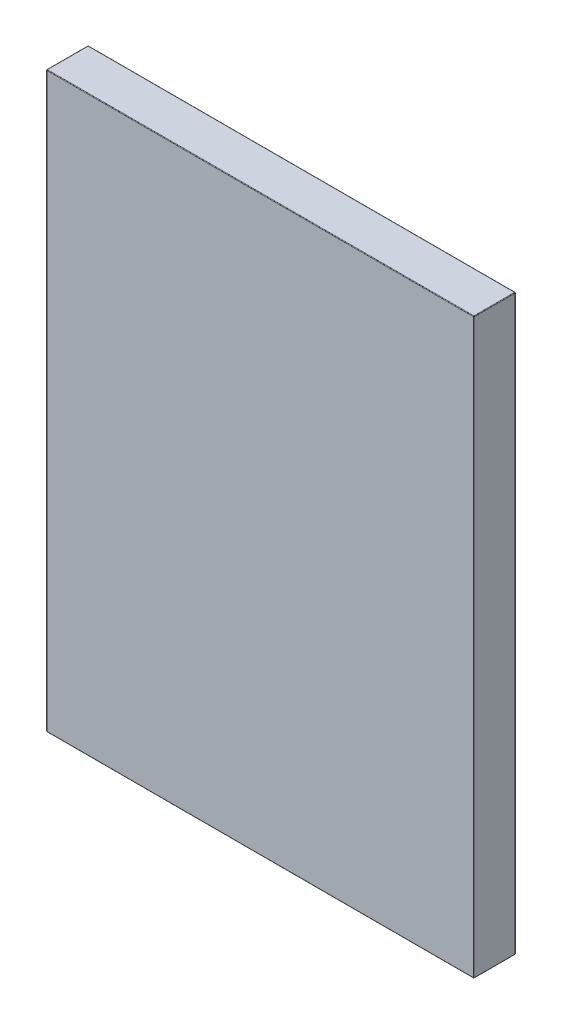
from build123d import *

# Parameters (mm, degrees)
SKETCH_1_W      = 820
SKETCH_1_H      = 1100
EXTRUDE_1_DEPTH = 80
FILLET_1_R      = 1
FILLET_2_R      = 1


with BuildPart() as part:
    # Эскиз1 → Бобышка-Вытянуть1 (new body)
    with BuildSketch(Plane.XY):
        Rectangle(SKETCH_1_W, SKETCH_1_H)
    extrude(amount=EXTRUDE_1_DEPTH)

    # Скругление1
    fillet_1_edges = [part.edges().sort_by_distance(p)[0] for p in [
        (0, -550, 0),
        (-410, 0, 0),
        (0, 550, 0),
        (410, 0, 0),
    ]]
    fillet(fillet_1_edges, radius=FILLET_1_R)

    # Скругление2
    # the kernel refuses this fillet: 1 mm, written as the material it takes off along each edge
    with BuildSketch(Plane(origin=(409, -549, 1), x_dir=(0, -1, 0), z_dir=(1, 0, 0))) as fillet_2_piece_1_section:
        Polygon((0, 0), (FILLET_2_R, 0), (FILLET_2_R, FILLET_2_R), (0, FILLET_2_R), align=None)
    fillet_2_piece_1 = extrude(amount=FILLET_2_R, mode=Mode.PRIVATE)
    fillet_2_piece_1 = fillet_2_piece_1 - Plane(origin=(409, -549, 1), x_dir=(0, 0.7071067811865475, 0.7071067811865475), z_dir=(1, 0, 0)) * Sphere(FILLET_2_R, mode=Mode.PRIVATE)
    add(fillet_2_piece_1, mode=Mode.SUBTRACT)
    with BuildSketch(Plane(origin=(-409, -549, 1), x_dir=(0, -1, 0), z_dir=(-1, 0, 0))) as fillet_2_piece_2_section:
        Polygon((0, 0), (FILLET_2_R, 0), (FILLET_2_R, -FILLET_2_R), (0, -FILLET_2_R), align=None)
    fillet_2_piece_2 = extrude(amount=FILLET_2_R, mode=Mode.PRIVATE)
    fillet_2_piece_2 = fillet_2_piece_2 - Plane(origin=(-409, -549, 1), x_dir=(0, 0.7071067811865475, 0.7071067811865475), z_dir=(-1, 0, 0)) * Sphere(FILLET_2_R, mode=Mode.PRIVATE)
    add(fillet_2_piece_2, mode=Mode.SUBTRACT)
    with BuildSketch(Plane(origin=(409, 549, 1), x_dir=(1, 0, 0), z_dir=(0, 1, 0))) as fillet_2_piece_3_section:
        Polygon((0, 0), (FILLET_2_R, 0), (FILLET_2_R, FILLET_2_R), (0, FILLET_2_R), align=None)
    fillet_2_piece_3 = extrude(amount=FILLET_2_R, mode=Mode.PRIVATE)
    fillet_2_piece_3 = fillet_2_piece_3 - Plane(origin=(409, 549, 1), x_dir=(-0.7071067811865475, 0, 0.7071067811865475), z_dir=(0, 1, 0)) * Sphere(FILLET_2_R, mode=Mode.PRIVATE)
    add(fillet_2_piece_3, mode=Mode.SUBTRACT)
    with BuildSketch(Plane(origin=(-409, 549, 1), x_dir=(-1, 0, 0), z_dir=(0, 1, 0))) as fillet_2_piece_4_section:
        Polygon((0, 0), (FILLET_2_R, 0), (FILLET_2_R, -FILLET_2_R), (0, -FILLET_2_R), align=None)
    fillet_2_piece_4 = extrude(amount=FILLET_2_R, mode=Mode.PRIVATE)
    fillet_2_piece_4 = fillet_2_piece_4 - Plane(origin=(-409, 549, 1), x_dir=(0.7071067811865475, 0, 0.7071067811865475), z_dir=(0, 1, 0)) * Sphere(FILLET_2_R, mode=Mode.PRIVATE)
    add(fillet_2_piece_4, mode=Mode.SUBTRACT)
    with BuildSketch(Plane(origin=(-409, -549, 79), x_dir=(0, 0, 1), z_dir=(-1, 0, 0))) as fillet_2_piece_5_section:
        Polygon((0, 0), (FILLET_2_R, 0), (FILLET_2_R, -FILLET_2_R), (0, -FILLET_2_R), align=None)
    fillet_2_piece_5 = extrude(amount=FILLET_2_R, mode=Mode.PRIVATE)
    fillet_2_piece_5 = fillet_2_piece_5 - Plane(origin=(-409, -549, 79), x_dir=(0, 0.7071067811865475, -0.7071067811865475), z_dir=(-1, 0, 0)) * Sphere(FILLET_2_R, mode=Mode.PRIVATE)
    add(fillet_2_piece_5, mode=Mode.SUBTRACT)
    with BuildSketch(Plane(origin=(-409, 549, 79), x_dir=(-1, 0, 0), z_dir=(0, 1, 0))) as fillet_2_piece_6_section:
        Polygon((0, 0), (FILLET_2_R, 0), (FILLET_2_R, FILLET_2_R), (0, FILLET_2_R), align=None)
    fillet_2_piece_6 = extrude(amount=FILLET_2_R, mode=Mode.PRIVATE)
    fillet_2_piece_6 = fillet_2_piece_6 - Plane(origin=(-409, 549, 79), x_dir=(0.7071067811865475, 0, -0.7071067811865475), z_dir=(0, 1, 0)) * Sphere(FILLET_2_R, mode=Mode.PRIVATE)
    add(fillet_2_piece_6, mode=Mode.SUBTRACT)
    with BuildSketch(Plane(origin=(409, -549, 79), x_dir=(1, 0, 0), z_dir=(0, 0, 1))) as fillet_2_piece_7_section:
        Polygon((0, 0), (FILLET_2_R, 0), (FILLET_2_R, -FILLET_2_R), (0, -FILLET_2_R), align=None)
    fillet_2_piece_7 = extrude(amount=FILLET_2_R, mode=Mode.PRIVATE)
    fillet_2_piece_7 = fillet_2_piece_7 - Plane(origin=(409, -549, 79), x_dir=(-0.7071067811865476, 0.7071067811865475, 0), z_dir=(0, 0, 1)) * Sphere(FILLET_2_R, mode=Mode.PRIVATE)
    add(fillet_2_piece_7, mode=Mode.SUBTRACT)
    with BuildSketch(Plane(origin=(409, 549, 79), x_dir=(0, 0, 1), z_dir=(0, 1, 0))) as fillet_2_piece_8_section:
        Polygon((0, 0), (FILLET_2_R, 0), (FILLET_2_R, FILLET_2_R), (0, FILLET_2_R), align=None)
    fillet_2_piece_8 = extrude(amount=FILLET_2_R, mode=Mode.PRIVATE)
    fillet_2_piece_8 = fillet_2_piece_8 - Plane(origin=(409, 549, 79), x_dir=(-0.7071067811865475, 0, -0.7071067811865475), z_dir=(0, 1, 0)) * Sphere(FILLET_2_R, mode=Mode.PRIVATE)
    add(fillet_2_piece_8, mode=Mode.SUBTRACT)
    with BuildSketch(Plane(origin=(-410, -549, 80), x_dir=(0, 0, -1), z_dir=(0, 1, 0))) as fillet_2_piece_9:
        with BuildLine():
            CenterArc((FILLET_2_R, -FILLET_2_R), FILLET_2_R, 90, 90)
            Line((0, -FILLET_2_R), (0, 0))
            Line((0, 0), (FILLET_2_R, 0))
        make_face()
    extrude(amount=1098, mode=Mode.SUBTRACT)
    with BuildSketch(Plane(origin=(409, -550, 80), x_dir=(0, 1, 0), z_dir=(-1, 0, 0))) as fillet_2_piece_10:
        with BuildLine():
            CenterArc((FILLET_2_R, FILLET_2_R), FILLET_2_R, 180, 90)
            Line((0, FILLET_2_R), (0, 0))
            Line((0, 0), (FILLET_2_R, 0))
        make_face()
    extrude(amount=818, mode=Mode.SUBTRACT)
    with BuildSketch(Plane(origin=(410, 549, 80), x_dir=(-1, 0, 0), z_dir=(0, -1, 0))) as fillet_2_piece_11:
        with BuildLine():
            CenterArc((FILLET_2_R, FILLET_2_R), FILLET_2_R, 180, 90)
            Line((0, FILLET_2_R), (0, 0))
            Line((0, 0), (FILLET_2_R, 0))
        make_face()
    extrude(amount=1098, mode=Mode.SUBTRACT)
    with BuildSketch(Plane(origin=(-409, 550, 80), x_dir=(0, 0, -1), z_dir=(1, 0, 0))) as fillet_2_piece_12:
        with BuildLine():
            CenterArc((FILLET_2_R, -FILLET_2_R), FILLET_2_R, 90, 90)
            Line((0, -FILLET_2_R), (0, 0))
            Line((0, 0), (FILLET_2_R, 0))
        make_face()
    extrude(amount=818, mode=Mode.SUBTRACT)
    with BuildSketch(Plane(origin=(410, -550, 1), x_dir=(0, 1, 0), z_dir=(0, 0, 1)), Plane(origin=(410, 550, 1), x_dir=(-1, 0, 0), z_dir=(0, 0, 1))) as fillet_2_piece_13:
        with BuildLine():
            CenterArc((FILLET_2_R, FILLET_2_R), FILLET_2_R, 180, 90)
            Line((0, FILLET_2_R), (0, 0))
            Line((0, 0), (FILLET_2_R, 0))
        make_face()
    extrude(amount=78, mode=Mode.SUBTRACT)
    with BuildSketch(Plane(origin=(-410, -550, 1), x_dir=(0, 1, 0), z_dir=(0, 0, 1)), Plane(origin=(-410, 550, 1), x_dir=(1, 0, 0), z_dir=(0, 0, 1))) as fillet_2_piece_14:
        with BuildLine():
            CenterArc((FILLET_2_R, -FILLET_2_R), FILLET_2_R, 90, 90)
            Line((0, -FILLET_2_R), (0, 0))
            Line((0, 0), (FILLET_2_R, 0))
        make_face()
    extrude(amount=78, mode=Mode.SUBTRACT)


solid = part.part
